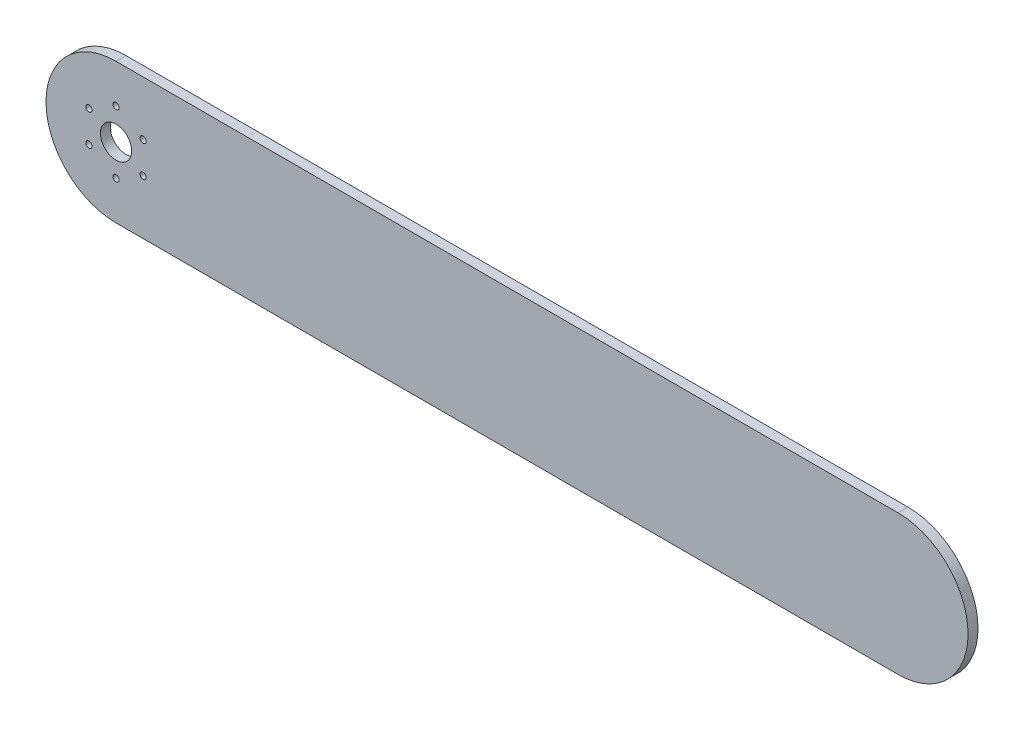
from build123d import *

# Parameters (mm, degrees)
SKETCH2_R           = 10
SKETCH2_R_2         = 2
BOSS_EXTRUDE1_DEPTH = 6.35


with BuildPart() as part:
    # Sketch2 → Boss-Extrude1 (new body)
    with BuildSketch(Plane.XY):
        with BuildLine():
            Line((0, 44.75), (500, 44.75))
            ThreePointArc((500, 44.75), (544.75, 0), (500, -44.75))
            Line((500, -44.75), (0, -44.75))
            ThreePointArc((0, -44.75), (-44.75, 0), (0, 44.75))
        make_face()
        Circle(SKETCH2_R, mode=Mode.SUBTRACT)
        with Locations((0, 20)):
            Circle(SKETCH2_R_2, mode=Mode.SUBTRACT)
        with Locations((17.320508076, 10)):
            Circle(SKETCH2_R_2, mode=Mode.SUBTRACT)
        with Locations((17.320508076, -10)):
            Circle(SKETCH2_R_2, mode=Mode.SUBTRACT)
        with Locations((0, -20)):
            Circle(SKETCH2_R_2, mode=Mode.SUBTRACT)
        with Locations((-17.320508076, -10)):
            Circle(SKETCH2_R_2, mode=Mode.SUBTRACT)
        with Locations((-17.320508076, 10)):
            Circle(SKETCH2_R_2, mode=Mode.SUBTRACT)
    extrude(amount=BOSS_EXTRUDE1_DEPTH)


solid = part.part
